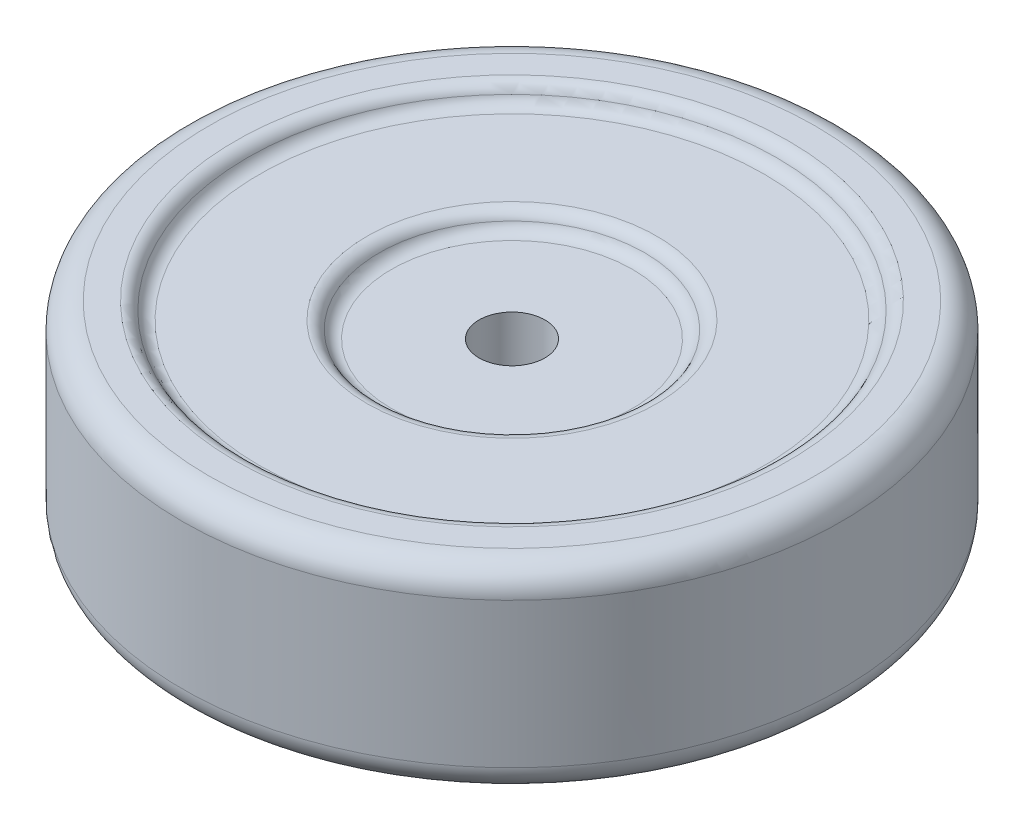
from build123d import *

# Parameters (mm, degrees)
SKETCH1_R            = 127
BOSS_EXTRUDE1_DEPTH  = 38.1
SKETCH2_R            = 101.6
CUT_EXTRUDE1_DEPTH   = 6.35
SKETCH3_R            = 50.8
CUT_EXTRUDE2_DEPTH   = 6.35
SKETCH4_R            = 12.7
CUT_EXTRUDE3_DEPTH   = 77.978
FILLET1_R            = 10.16
FILLET2_R            = 5.08
FILLET3_R            = 5.08
FILLET4_R            = 5.08
FILLET5_R            = 5.08
FILLET1_OF_MIRROR1_R = 10.16
FILLET2_OF_MIRROR1_R = 5.08
FILLET3_OF_MIRROR1_R = 5.08
FILLET4_OF_MIRROR1_R = 5.08
FILLET5_OF_MIRROR1_R = 5.08


with BuildPart() as part:
    # Sketch1 → Boss-Extrude1 (new body)
    with BuildSketch(Plane(origin=(0, 0, 0), x_dir=(1, 0, 0), z_dir=(0, 1, 0))):
        Circle(SKETCH1_R)
    boss_extrude1 = extrude(amount=BOSS_EXTRUDE1_DEPTH)

    # Sketch2 → Cut-Extrude1 (cut)
    with BuildSketch(Plane(origin=(0, 38.1, 0), x_dir=(1, 0, 0), z_dir=(0, 1, 0))):
        Circle(SKETCH2_R)
    cut_extrude1 = extrude(amount=-CUT_EXTRUDE1_DEPTH, mode=Mode.SUBTRACT)

    # Sketch3 → Cut-Extrude2 (cut)
    with BuildSketch(Plane(origin=(0, 31.75, 0), x_dir=(1, 0, 0), z_dir=(0, 1, 0))):
        Circle(SKETCH3_R)
    cut_extrude2 = extrude(amount=-CUT_EXTRUDE2_DEPTH, mode=Mode.SUBTRACT)

    # Sketch4 → Cut-Extrude3 (cut)
    with BuildSketch(Plane(origin=(0, 25.4, 0), x_dir=(1, 0, 0), z_dir=(0, 1, 0))):
        Circle(SKETCH4_R)
    cut_extrude3 = extrude(amount=-CUT_EXTRUDE3_DEPTH, mode=Mode.SUBTRACT)

    # Fillet1
    fillet1_edges = [part.edges().sort_by_distance(p)[0] for p in [
        (-127, 38.1, 0),
    ]]
    fillet(fillet1_edges, radius=FILLET1_R)

    # Fillet2
    fillet2_edges = [part.edges().sort_by_distance(p)[0] for p in [
        (-101.6, 38.1, 0),
    ]]
    fillet(fillet2_edges, radius=FILLET2_R)

    # Fillet3
    fillet3_edges = [part.edges().sort_by_distance(p)[0] for p in [
        (-101.6, 31.75, 0),
    ]]
    fillet(fillet3_edges, radius=FILLET3_R)

    # Fillet4
    fillet4_edges = [part.edges().sort_by_distance(p)[0] for p in [
        (-50.8, 31.75, 0),
    ]]
    fillet(fillet4_edges, radius=FILLET4_R)

    # Fillet5
    fillet5_edges = [part.edges().sort_by_distance(p)[0] for p in [
        (-50.8, 25.4, 0),
    ]]
    fillet(fillet5_edges, radius=FILLET5_R)

    # Mirror1: Boss-Extrude1, Cut-Extrude1, Cut-Extrude2, Cut-Extrude3 across plane
    add(boss_extrude1.mirror(Plane.ZX))
    add(cut_extrude1.mirror(Plane.ZX), mode=Mode.SUBTRACT)
    add(cut_extrude2.mirror(Plane.ZX), mode=Mode.SUBTRACT)
    add(cut_extrude3.mirror(Plane.ZX), mode=Mode.SUBTRACT)

    # Fillet1 of Mirror1
    fillet1_of_mirror1_edges = [part.edges().sort_by_distance(p)[0] for p in [
        (-127, -38.1, 0),
    ]]
    fillet(fillet1_of_mirror1_edges, radius=FILLET1_OF_MIRROR1_R)

    # Fillet2 of Mirror1
    fillet2_of_mirror1_edges = [part.edges().sort_by_distance(p)[0] for p in [
        (-101.6, -38.1, 0),
    ]]
    fillet(fillet2_of_mirror1_edges, radius=FILLET2_OF_MIRROR1_R)

    # Fillet3 of Mirror1
    fillet3_of_mirror1_edges = [part.edges().sort_by_distance(p)[0] for p in [
        (-101.6, -31.75, 0),
    ]]
    fillet(fillet3_of_mirror1_edges, radius=FILLET3_OF_MIRROR1_R)

    # Fillet4 of Mirror1
    fillet4_of_mirror1_edges = [part.edges().sort_by_distance(p)[0] for p in [
        (-50.8, -31.75, 0),
    ]]
    fillet(fillet4_of_mirror1_edges, radius=FILLET4_OF_MIRROR1_R)

    # Fillet5 of Mirror1
    fillet5_of_mirror1_edges = [part.edges().sort_by_distance(p)[0] for p in [
        (-50.8, -25.4, 0),
    ]]
    fillet(fillet5_of_mirror1_edges, radius=FILLET5_OF_MIRROR1_R)


solid = part.part
